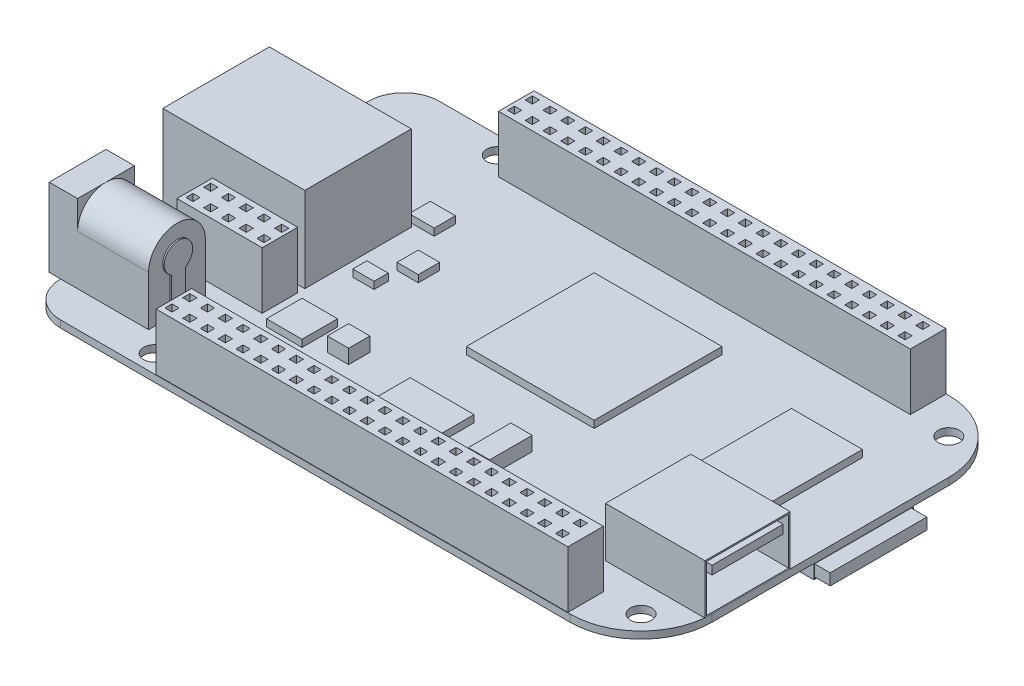
from build123d import *

# Parameters (mm, degrees)
SKETCH1_R               = 1.5
BOSS_EXTRUDE3_DEPTH     = 1
SKETCH2_W               = 12
SKETCH2_H               = 5
SKETCH2_W_2             = 58
BOSS_EXTRUDE5_DEPTH     = 8
SKETCH3_W               = 1
SKETCH3_H               = 1
CUT_EXTRUDE2_DEPTH      = 7
SKETCH4_W               = 20
SKETCH4_H               = 15
BOSS_EXTRUDE6_DEPTH     = 12
CUT_EXTRUDE3_DEPTH      = 15
SKETCH6_W               = 14
SKETCH6_H               = 8
BOSS_EXTRUDE7_DEPTH     = 11
CUT_EXTRUDE5_DEPTH      = 10
SKETCH9_R               = 3
SKETCH9_R_2             = 0.2
CUT_EXTRUDE6_DEPTH      = 10
SKETCH10_W              = 14
SKETCH10_H              = 12
BOSS_EXTRUDE9_DEPTH     = 7
SKETCH11_W              = 11.6
SKETCH11_H              = 6.6
SKETCH11_W_2            = 10
SKETCH11_H_2            = 1.2
CUT_EXTRUDE7_DEPTH      = 10
SKETCH12_W              = 15
SKETCH12_H              = 14
BOSS_EXTRUDE11_DEPTH    = 2
SHELL1_T                = -0.1
SKETCH13_W              = 13.6
SKETCH13_H              = 1.6
BOSS_EXTRUDE12_DEPTH    = 17
SKETCH14_W              = 18
SKETCH14_H              = 18
BOSS_EXTRUDE13_DEPTH    = 1
SKETCH14_W_2            = 10
SKETCH14_H_2            = 13
BOSS_EXTRUDE13_2_DEPTH  = 1
SKETCH14_W_3            = 3.540159879
SKETCH14_H_3            = 3
BOSS_EXTRUDE13_3_DEPTH  = 1
SKETCH14_W_4            = 3
BOSS_EXTRUDE13_4_DEPTH  = 1
SKETCH14_H_4            = 2
BOSS_EXTRUDE13_5_DEPTH  = 1
SKETCH14_W_5            = 9
SKETCH14_H_5            = 9
BOSS_EXTRUDE13_6_DEPTH  = 1
SKETCH14_W_6            = 5
SKETCH14_H_6            = 5
BOSS_EXTRUDE13_7_DEPTH  = 1
SKETCH15_W              = 8
SKETCH15_H              = 7
BOSS_EXTRUDE14_DEPTH    = 4
CUT_EXTRUDE8_DEPTH      = 94.673517471
CUT_EXTRUDE8_DEPTH_BACK = 94.673517471
SHELL2_T                = -0.1
BOSS_EXTRUDE15_DEPTH    = 7
SKETCH18_R              = 0.1
CUT_EXTRUDE9_DEPTH      = 6
SKETCH19_W              = 3
SKETCH19_H              = 3
SKETCH19_H_2            = 6
SKETCH19_W_2            = 1.784134307
SKETCH19_H_3            = 3.811559656
BOSS_EXTRUDE17_DEPTH    = 2
BOSS_EXTRUDE18_DEPTH    = 0.2


with BuildPart() as part:
    # Sketch1 → Boss-Extrude3 (new body)
    with BuildSketch(Plane(origin=(0, 0, 0), x_dir=(1, 0, 0), z_dir=(0, 1, 0))):
        with BuildLine():
            Line((-38.570655458, -26.67), (33.18, -26.67))
            ThreePointArc((33.18, -26.67), (40.251067812, -23.741067812), (43.18, -16.67))
            Line((43.18, -16.67), (43.18, 16.67))
            ThreePointArc((43.18, 16.67), (40.251067812, 23.741067812), (33.18, 26.67))
            Line((33.18, 26.67), (-38.570655458, 26.67))
            ThreePointArc((-38.570655458, 26.67), (-42.106189364, 25.205533906), (-43.570655458, 21.67))
            Line((-43.570655458, 21.67), (-43.570655458, -21.67))
            ThreePointArc((-43.570655458, -21.67), (-42.106189364, -25.205533906), (-38.570655458, -26.67))
        make_face()
        with Locations((38.18, -21.67)):
            Circle(SKETCH1_R, mode=Mode.SUBTRACT)
        with Locations((38.18, 21.67)):
            Circle(SKETCH1_R, mode=Mode.SUBTRACT)
        with Locations((-27.89690939, -24.16)):
            Circle(SKETCH1_R, mode=Mode.SUBTRACT)
        with Locations((-27.89690939, 24.16)):
            Circle(SKETCH1_R, mode=Mode.SUBTRACT)
    extrude(amount=BOSS_EXTRUDE3_DEPTH)

    # Sketch2 → Boss-Extrude5 (add)
    with BuildSketch(Plane(origin=(0, 1, 0), x_dir=(1, 0, 0), z_dir=(0, 1, 0))):
        with Locations((-31.18, -9.17)):
            Rectangle(SKETCH2_W, SKETCH2_H)
        with Locations((3.82, -24.12)):
            Rectangle(SKETCH2_W_2, SKETCH2_H)
        with Locations((3.82, 24.12)):
            Rectangle(SKETCH2_W_2, SKETCH2_H)
    extrude(amount=BOSS_EXTRUDE5_DEPTH)

    # Sketch3 → Cut-Extrude2 (cut)
    with BuildSketch(Plane(origin=(0, 9, 0), x_dir=(1, 0, 0), z_dir=(0, 1, 0))):
        with Locations((-21.68, 25.37)):
            Rectangle(SKETCH3_W, SKETCH3_H)
        with Locations((-21.68, -22.87)):
            Rectangle(SKETCH3_W, SKETCH3_H)
        with Locations((-24.18, 25.37)):
            Rectangle(SKETCH3_W, SKETCH3_H)
        with Locations((-19.18, 25.37)):
            Rectangle(SKETCH3_W, SKETCH3_H)
        with Locations((-16.68, 25.37)):
            Rectangle(SKETCH3_W, SKETCH3_H)
        with Locations((-14.18, 25.37)):
            Rectangle(SKETCH3_W, SKETCH3_H)
        with Locations((-11.68, 25.37)):
            Rectangle(SKETCH3_W, SKETCH3_H)
        with Locations((-9.18, 25.37)):
            Rectangle(SKETCH3_W, SKETCH3_H)
        with Locations((-6.68, 25.37)):
            Rectangle(SKETCH3_W, SKETCH3_H)
        with Locations((-4.18, 25.37)):
            Rectangle(SKETCH3_W, SKETCH3_H)
        with Locations((-1.68, 25.37)):
            Rectangle(SKETCH3_W, SKETCH3_H)
        with Locations((0.82, 25.37)):
            Rectangle(SKETCH3_W, SKETCH3_H)
        with Locations((3.32, 25.37)):
            Rectangle(SKETCH3_W, SKETCH3_H)
        with Locations((5.82, 25.37)):
            Rectangle(SKETCH3_W, SKETCH3_H)
        with Locations((8.32, 25.37)):
            Rectangle(SKETCH3_W, SKETCH3_H)
        with Locations((10.82, 25.37)):
            Rectangle(SKETCH3_W, SKETCH3_H)
        with Locations((13.32, 25.37)):
            Rectangle(SKETCH3_W, SKETCH3_H)
        with Locations((15.82, 25.37)):
            Rectangle(SKETCH3_W, SKETCH3_H)
        with Locations((18.32, 25.37)):
            Rectangle(SKETCH3_W, SKETCH3_H)
        with Locations((20.82, 25.37)):
            Rectangle(SKETCH3_W, SKETCH3_H)
        with Locations((23.32, 25.37)):
            Rectangle(SKETCH3_W, SKETCH3_H)
        with Locations((25.82, 25.37)):
            Rectangle(SKETCH3_W, SKETCH3_H)
        with Locations((28.32, 25.37)):
            Rectangle(SKETCH3_W, SKETCH3_H)
        with Locations((30.82, 25.37)):
            Rectangle(SKETCH3_W, SKETCH3_H)
        with Locations((-19.18, 22.87)):
            Rectangle(SKETCH3_W, SKETCH3_H)
        with Locations((-21.68, 22.87)):
            Rectangle(SKETCH3_W, SKETCH3_H)
        with Locations((-24.18, 22.87)):
            Rectangle(SKETCH3_W, SKETCH3_H)
        with Locations((30.82, 22.87)):
            Rectangle(SKETCH3_W, SKETCH3_H)
        with Locations((28.32, 22.87)):
            Rectangle(SKETCH3_W, SKETCH3_H)
        with Locations((25.82, 22.87)):
            Rectangle(SKETCH3_W, SKETCH3_H)
        with Locations((23.32, 22.87)):
            Rectangle(SKETCH3_W, SKETCH3_H)
        with Locations((20.82, 22.87)):
            Rectangle(SKETCH3_W, SKETCH3_H)
        with Locations((18.32, 22.87)):
            Rectangle(SKETCH3_W, SKETCH3_H)
        with Locations((15.82, 22.87)):
            Rectangle(SKETCH3_W, SKETCH3_H)
        with Locations((13.32, 22.87)):
            Rectangle(SKETCH3_W, SKETCH3_H)
        with Locations((10.82, 22.87)):
            Rectangle(SKETCH3_W, SKETCH3_H)
        with Locations((8.32, 22.87)):
            Rectangle(SKETCH3_W, SKETCH3_H)
        with Locations((5.82, 22.87)):
            Rectangle(SKETCH3_W, SKETCH3_H)
        with Locations((3.32, 22.87)):
            Rectangle(SKETCH3_W, SKETCH3_H)
        with Locations((0.82, 22.87)):
            Rectangle(SKETCH3_W, SKETCH3_H)
        with Locations((-1.68, 22.87)):
            Rectangle(SKETCH3_W, SKETCH3_H)
        with Locations((-4.18, 22.87)):
            Rectangle(SKETCH3_W, SKETCH3_H)
        with Locations((-6.68, 22.87)):
            Rectangle(SKETCH3_W, SKETCH3_H)
        with Locations((-9.18, 22.87)):
            Rectangle(SKETCH3_W, SKETCH3_H)
        with Locations((-11.68, 22.87)):
            Rectangle(SKETCH3_W, SKETCH3_H)
        with Locations((-14.18, 22.87)):
            Rectangle(SKETCH3_W, SKETCH3_H)
        with Locations((-16.68, 22.87)):
            Rectangle(SKETCH3_W, SKETCH3_H)
        with Locations((-24.18, -22.87)):
            Rectangle(SKETCH3_W, SKETCH3_H)
        with Locations((-19.18, -22.87)):
            Rectangle(SKETCH3_W, SKETCH3_H)
        with Locations((-16.68, -22.87)):
            Rectangle(SKETCH3_W, SKETCH3_H)
        with Locations((-14.18, -22.87)):
            Rectangle(SKETCH3_W, SKETCH3_H)
        with Locations((-11.68, -22.87)):
            Rectangle(SKETCH3_W, SKETCH3_H)
        with Locations((-9.18, -22.87)):
            Rectangle(SKETCH3_W, SKETCH3_H)
        with Locations((-6.68, -22.87)):
            Rectangle(SKETCH3_W, SKETCH3_H)
        with Locations((-4.18, -22.87)):
            Rectangle(SKETCH3_W, SKETCH3_H)
        with Locations((-1.68, -22.87)):
            Rectangle(SKETCH3_W, SKETCH3_H)
        with Locations((0.82, -22.87)):
            Rectangle(SKETCH3_W, SKETCH3_H)
        with Locations((3.32, -22.87)):
            Rectangle(SKETCH3_W, SKETCH3_H)
        with Locations((5.82, -22.87)):
            Rectangle(SKETCH3_W, SKETCH3_H)
        with Locations((8.32, -22.87)):
            Rectangle(SKETCH3_W, SKETCH3_H)
        with Locations((10.82, -22.87)):
            Rectangle(SKETCH3_W, SKETCH3_H)
        with Locations((13.32, -22.87)):
            Rectangle(SKETCH3_W, SKETCH3_H)
        with Locations((15.82, -22.87)):
            Rectangle(SKETCH3_W, SKETCH3_H)
        with Locations((18.32, -22.87)):
            Rectangle(SKETCH3_W, SKETCH3_H)
        with Locations((20.82, -22.87)):
            Rectangle(SKETCH3_W, SKETCH3_H)
        with Locations((23.32, -22.87)):
            Rectangle(SKETCH3_W, SKETCH3_H)
        with Locations((25.82, -22.87)):
            Rectangle(SKETCH3_W, SKETCH3_H)
        with Locations((28.32, -22.87)):
            Rectangle(SKETCH3_W, SKETCH3_H)
        with Locations((30.82, -22.87)):
            Rectangle(SKETCH3_W, SKETCH3_H)
        with Locations((30.82, -25.37)):
            Rectangle(SKETCH3_W, SKETCH3_H)
        with Locations((28.32, -25.37)):
            Rectangle(SKETCH3_W, SKETCH3_H)
        with Locations((25.82, -25.37)):
            Rectangle(SKETCH3_W, SKETCH3_H)
        with Locations((23.32, -25.37)):
            Rectangle(SKETCH3_W, SKETCH3_H)
        with Locations((20.82, -25.37)):
            Rectangle(SKETCH3_W, SKETCH3_H)
        with Locations((18.32, -25.37)):
            Rectangle(SKETCH3_W, SKETCH3_H)
        with Locations((15.82, -25.37)):
            Rectangle(SKETCH3_W, SKETCH3_H)
        with Locations((13.32, -25.37)):
            Rectangle(SKETCH3_W, SKETCH3_H)
        with Locations((10.82, -25.37)):
            Rectangle(SKETCH3_W, SKETCH3_H)
        with Locations((8.32, -25.37)):
            Rectangle(SKETCH3_W, SKETCH3_H)
        with Locations((5.82, -25.37)):
            Rectangle(SKETCH3_W, SKETCH3_H)
        with Locations((3.32, -25.37)):
            Rectangle(SKETCH3_W, SKETCH3_H)
        with Locations((0.82, -25.37)):
            Rectangle(SKETCH3_W, SKETCH3_H)
        with Locations((-1.68, -25.37)):
            Rectangle(SKETCH3_W, SKETCH3_H)
        with Locations((-4.18, -25.37)):
            Rectangle(SKETCH3_W, SKETCH3_H)
        with Locations((-6.68, -25.37)):
            Rectangle(SKETCH3_W, SKETCH3_H)
        with Locations((-9.18, -25.37)):
            Rectangle(SKETCH3_W, SKETCH3_H)
        with Locations((-11.68, -25.37)):
            Rectangle(SKETCH3_W, SKETCH3_H)
        with Locations((-14.18, -25.37)):
            Rectangle(SKETCH3_W, SKETCH3_H)
        with Locations((-16.68, -25.37)):
            Rectangle(SKETCH3_W, SKETCH3_H)
        with Locations((-19.18, -25.37)):
            Rectangle(SKETCH3_W, SKETCH3_H)
        with Locations((-21.68, -25.37)):
            Rectangle(SKETCH3_W, SKETCH3_H)
        with Locations((-24.18, -25.37)):
            Rectangle(SKETCH3_W, SKETCH3_H)
        with Locations((-28.68, -10.42)):
            Rectangle(SKETCH3_W, SKETCH3_H)
        with Locations((-26.18, -10.42)):
            Rectangle(SKETCH3_W, SKETCH3_H)
        with Locations((-31.18, -10.42)):
            Rectangle(SKETCH3_W, SKETCH3_H)
        with Locations((-33.68, -10.42)):
            Rectangle(SKETCH3_W, SKETCH3_H)
        with Locations((-36.18, -10.42)):
            Rectangle(SKETCH3_W, SKETCH3_H)
        with Locations((-36.18, -7.92)):
            Rectangle(SKETCH3_W, SKETCH3_H)
        with Locations((-33.68, -7.92)):
            Rectangle(SKETCH3_W, SKETCH3_H)
        with Locations((-31.18, -7.92)):
            Rectangle(SKETCH3_W, SKETCH3_H)
        with Locations((-28.68, -7.92)):
            Rectangle(SKETCH3_W, SKETCH3_H)
        with Locations((-26.18, -7.92)):
            Rectangle(SKETCH3_W, SKETCH3_H)
    extrude(amount=-CUT_EXTRUDE2_DEPTH, mode=Mode.SUBTRACT)

    # Sketch4 → Boss-Extrude6 (add)
    with BuildSketch(Plane(origin=(0, 1, 0), x_dir=(1, 0, 0), z_dir=(0, 1, 0))):
        with Locations((-35.18, 1.83)):
            Rectangle(SKETCH4_W, SKETCH4_H)
    extrude(amount=BOSS_EXTRUDE6_DEPTH)

    # Sketch5 → Cut-Extrude3 (cut)
    with BuildSketch(Plane.ZY.offset(45.18)):
        Polygon((-4.33, 2), (-5.33, 2), (-5.33, 4), (-8.33, 4), (-8.33, 11), (4.67, 11), (4.67, 4), (1.67, 4), (1.67, 2), (0.67, 2), (0.67, 1.05), (-4.33, 1.05), align=None)
    extrude(amount=-CUT_EXTRUDE3_DEPTH, mode=Mode.SUBTRACT)

    # Sketch6 → Boss-Extrude7 (add)
    with BuildSketch(Plane(origin=(0, 1, 0), x_dir=(1, 0, 0), z_dir=(0, 1, 0))):
        with Locations((-38.18, -17.67)):
            Rectangle(SKETCH6_W, SKETCH6_H)
    extrude(amount=BOSS_EXTRUDE7_DEPTH)

    # Sketch8 → Cut-Extrude5 (cut)
    with BuildSketch(Plane(origin=(-31.18, 0, 0), x_dir=(0, 0, -1), z_dir=(1, 0, 0))):
        with BuildLine():
            ThreePointArc((-17.67, 12), (-14.841572875, 10.828427125), (-13.67, 8))
            Line((-13.67, 8), (-13.67, 12))
            Line((-13.67, 12), (-17.67, 12))
        make_face()
        with BuildLine():
            ThreePointArc((-21.67, 8), (-20.498427125, 10.828427125), (-17.67, 12))
            Line((-17.67, 12), (-21.67, 12))
            Line((-21.67, 12), (-21.67, 8))
        make_face()
    extrude(amount=-CUT_EXTRUDE5_DEPTH, mode=Mode.SUBTRACT)

    # Sketch9 → Cut-Extrude6 (cut)
    with BuildSketch(Plane.ZY.offset(45.18)):
        with Locations((17.67, 8)):
            Circle(SKETCH9_R)
        with Locations((17.67, 8)):
            Circle(SKETCH9_R_2, mode=Mode.SUBTRACT)
    extrude(amount=-CUT_EXTRUDE6_DEPTH, mode=Mode.SUBTRACT)

    # Sketch19 → Boss-Extrude17 (add)
    with BuildSketch(Plane(origin=(0, 1, 0), x_dir=(1, 0, 0), z_dir=(0, 1, 0))):
        with Locations((-17.597159489, -18.143567327)):
            Rectangle(SKETCH19_W, SKETCH19_H)
        with Locations((-23.128561119, -18.143567327)):
            Rectangle(SKETCH19_W, SKETCH19_H)
        with Locations((-14.335050835, -10.342872721)):
            Rectangle(SKETCH19_W, SKETCH19_H)
        with Locations((9.208863795, -12.530473807)):
            Rectangle(SKETCH19_W, SKETCH19_H_2)
        with Locations((27.18650391, -11.971397323)):
            Rectangle(SKETCH19_W_2, SKETCH19_H_3)
    extrude(amount=BOSS_EXTRUDE17_DEPTH)

    # Sketch20 → Boss-Extrude18 (add)
    with BuildSketch(Plane(origin=(-31.18, 0, 0), x_dir=(0, 0, -1), z_dir=(1, 0, 0))):
        with BuildLine():
            Line((-18.67, 6.267949192), (-18.67, 1))
            Line((-18.67, 1), (-16.67, 1))
            Line((-16.67, 1), (-16.67, 6.267949192))
            ThreePointArc((-16.67, 6.267949192), (-17.67, 10), (-18.67, 6.267949192))
        make_face()
    extrude(amount=BOSS_EXTRUDE18_DEPTH)


with BuildPart() as body_2:
    # Sketch10 → Boss-Extrude9 (new body)
    with BuildSketch(Plane(origin=(0, 1, 0), x_dir=(1, 0, 0), z_dir=(0, 1, 0))):
        with Locations((36.18, -11.67)):
            Rectangle(SKETCH10_W, SKETCH10_H)
    extrude(amount=BOSS_EXTRUDE9_DEPTH)

    # Sketch11 → Cut-Extrude7 (cut)
    with BuildSketch(Plane(origin=(43.18, 0, 0), x_dir=(0, 0, -1), z_dir=(1, 0, 0))):
        with Locations((-11.67, 4.5)):
            Rectangle(SKETCH11_W, SKETCH11_H)
        with Locations((-11.67, 6.352552878)):
            Rectangle(SKETCH11_W_2, SKETCH11_H_2, mode=Mode.SUBTRACT)
    extrude(amount=-CUT_EXTRUDE7_DEPTH, mode=Mode.SUBTRACT)


with BuildPart() as body_3:
    # Sketch12 → Boss-Extrude11 (new body)
    with BuildSketch(Plane.XZ):
        with Locations((35.68, -4.67)):
            Rectangle(SKETCH12_W, SKETCH12_H)
    extrude(amount=BOSS_EXTRUDE11_DEPTH)

    # Shell1
    shell1_openings = [body_3.faces().sort_by_distance(p)[0] for p in [
        (43.18, -1, -4.67),
    ]]
    offset(amount=SHELL1_T, openings=shell1_openings, kind=Kind.INTERSECTION)

    # Sketch13 → Boss-Extrude12 (add)
    with BuildSketch(Plane(origin=(28.28, 0, 0), x_dir=(0, 0, -1), z_dir=(1, 0, 0))):
        with Locations((4.67, -0.992724209)):
            Rectangle(SKETCH13_W, SKETCH13_H)
    extrude(amount=BOSS_EXTRUDE12_DEPTH)


with BuildPart() as body_4:
    # Sketch14 → Boss-Extrude13 (new body)
    with BuildSketch(Plane(origin=(0, 1, 0), x_dir=(1, 0, 0), z_dir=(0, 1, 0))):
        with Locations((3.244137797, 6.663494479)):
            Rectangle(SKETCH14_W, SKETCH14_H)
    extrude(amount=BOSS_EXTRUDE13_DEPTH)


with BuildPart() as body_5:
    # Sketch14 → Boss-Extrude13 2 (new body)
    with BuildSketch(Plane(origin=(0, 1, 0), x_dir=(1, 0, 0), z_dir=(0, 1, 0))):
        with Locations((29.689512762, 6.5)):
            Rectangle(SKETCH14_W_2, SKETCH14_H_2)
    extrude(amount=BOSS_EXTRUDE13_2_DEPTH)


with BuildPart() as body_6:
    # Sketch14 → Boss-Extrude13 3 (new body)
    with BuildSketch(Plane(origin=(0, 1, 0), x_dir=(1, 0, 0), z_dir=(0, 1, 0))):
        with Locations((-24.235496774, 11.341644465)):
            Rectangle(SKETCH14_W_3, SKETCH14_H_3)
    extrude(amount=BOSS_EXTRUDE13_3_DEPTH)


with BuildPart() as body_7:
    # Sketch14 → Boss-Extrude13 4 (new body)
    with BuildSketch(Plane(origin=(0, 1, 0), x_dir=(1, 0, 0), z_dir=(0, 1, 0))):
        with Locations((-19.407746488, 4.544537497)):
            Rectangle(SKETCH14_W_4, SKETCH14_H_3)
    extrude(amount=BOSS_EXTRUDE13_4_DEPTH)


with BuildPart() as body_8:
    # Sketch14 → Boss-Extrude13 5 (new body)
    with BuildSketch(Plane(origin=(0, 1, 0), x_dir=(1, 0, 0), z_dir=(0, 1, 0))):
        with Locations((-21.711565187, 0.116495093)):
            Rectangle(SKETCH14_W_4, SKETCH14_H_4)
    extrude(amount=BOSS_EXTRUDE13_5_DEPTH)


with BuildPart() as body_9:
    # Sketch14 → Boss-Extrude13 6 (new body)
    with BuildSketch(Plane(origin=(0, 1, 0), x_dir=(1, 0, 0), z_dir=(0, 1, 0))):
        with Locations((-1.406894063, -14.595421376)):
            Rectangle(SKETCH14_W_5, SKETCH14_H_5)
    extrude(amount=BOSS_EXTRUDE13_6_DEPTH)


with BuildPart() as body_10:
    # Sketch14 → Boss-Extrude13 7 (new body)
    with BuildSketch(Plane(origin=(0, 1, 0), x_dir=(1, 0, 0), z_dir=(0, 1, 0))):
        with Locations((-20.711565187, -10.524782553)):
            Rectangle(SKETCH14_W_6, SKETCH14_H_6)
    extrude(amount=BOSS_EXTRUDE13_7_DEPTH)


with BuildPart() as body_11:
    # Sketch15 → Boss-Extrude14 (new body)
    with BuildSketch(Plane.XZ):
        with Locations((-39.570655458, -18.17)):
            Rectangle(SKETCH15_W, SKETCH15_H)
    extrude(amount=BOSS_EXTRUDE14_DEPTH)

    # Sketch16 → Cut-Extrude8 (cut, two sides: drawn at the far end of the back side and taken through both)
    with BuildSketch(Plane.ZY.offset(43.570655458).offset(-CUT_EXTRUDE8_DEPTH_BACK)):
        Polygon((-21.67, 0), (-21.67, -0.5), (-21.17, 0), align=None)
        Polygon((-14.67, 0), (-15.17, 0), (-14.67, -0.5), align=None)
    extrude(amount=CUT_EXTRUDE8_DEPTH + CUT_EXTRUDE8_DEPTH_BACK, mode=Mode.SUBTRACT)

    # Shell2
    shell2_openings = [body_11.faces().sort_by_distance(p)[0] for p in [
        (-43.570655458, -2.016516517, -18.17),
    ]]
    offset(amount=SHELL2_T, openings=shell2_openings, kind=Kind.INTERSECTION)


with BuildPart() as body_12:
    # Sketch17 → Boss-Extrude15 (new body)
    with BuildSketch(Plane.ZY.offset(35.670655458)):
        Polygon((-21.075025253, -1.036396103), (-21.075025253, -2.036396103), (-15.264974747, -2.036396103), (-15.264974747, -1.036396103), (-15.50137085, -0.8), (-20.83862915, -0.8), align=None)
    extrude(amount=BOSS_EXTRUDE15_DEPTH)

    # Sketch18 → Cut-Extrude9 (cut)
    with BuildSketch(Plane.ZY.offset(42.670655458)):
        with Locations((-20.549170488, -1.468317207)):
            Circle(SKETCH18_R)
        with Locations((-19.349170488, -1.468317207)):
            Circle(SKETCH18_R)
        with Locations((-18.149170488, -1.468317207)):
            Circle(SKETCH18_R)
        with Locations((-16.949170488, -1.468317207)):
            Circle(SKETCH18_R)
        with Locations((-15.749170488, -1.468317207)):
            Circle(SKETCH18_R)
    extrude(amount=-CUT_EXTRUDE9_DEPTH, mode=Mode.SUBTRACT)


solid = Compound([part.part, body_2.part, body_3.part, body_4.part, body_5.part, body_6.part, body_7.part, body_8.part, body_9.part, body_10.part, body_11.part, body_12.part])
